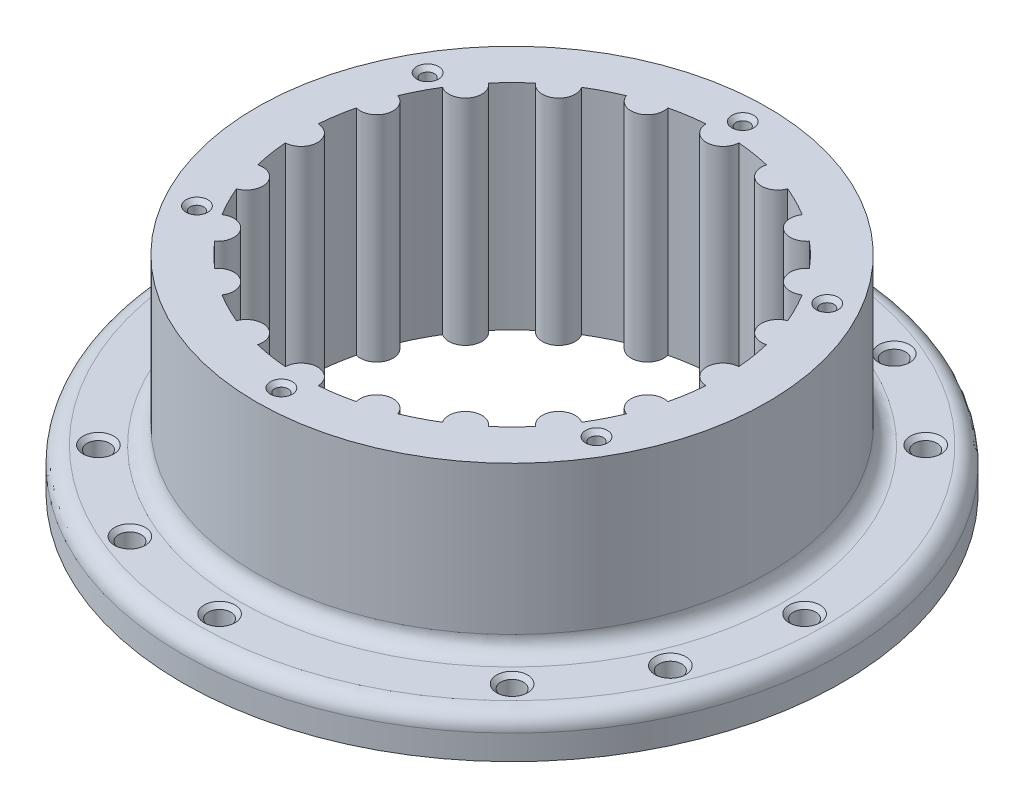
from build123d import *

# Parameters (mm, degrees)
SKETCH1_R                       = 80
SKETCH1_R_2                     = 62
BOSS_EXTRUDE1_DEPTH             = 10
BOSS_EXTRUDE2_DEPTH             = 40
BOSS_EXTRUDE2_DEPTH_BACK        = 12
SKETCH4_R                       = 62
SKETCH4_R_2                     = 51.2
BOSS_EXTRUDE3_REACH             = 122
BOSS_EXTRUDE3_DIRECTION_2_REACH = 122
CIRPATTERN1_COUNT               = 20
SKETCH8_R                       = 2.75
CUT_EXTRUDE4_DEPTH              = 121
CHAMFER1_SIZE                   = 1
CIRPATTERN2_COUNT               = 8
CHAMFER1_OF_CIRPATTERN2_SIZE    = 1
CHAMFER2_SIZE                   = 0.5
SKETCH9_R                       = 1.65
CUT_EXTRUDE5_DEPTH              = 15
CHAMFER3_SIZE                   = 1
SKETCH10_R                      = 2.75
CUT_EXTRUDE6_DEPTH              = 121
CHAMFER4_SIZE                   = 1
CIRPATTERN4_COUNT               = 4
CHAMFER4_OF_CIRPATTERN4_SIZE    = 1
CIRPATTERN3_COUNT               = 6
CHAMFER3_OF_CIRPATTERN3_SIZE    = 1
FILLET1_R                       = 4
FILLET2_R                       = 4


with BuildPart() as part:
    # Sketch1 → Boss-Extrude1 (new body)
    with BuildSketch(Plane(origin=(0, 0, 0), x_dir=(1, 0, 0), z_dir=(0, 1, 0))):
        Circle(SKETCH1_R)
        Circle(SKETCH1_R_2, mode=Mode.SUBTRACT)
    extrude(amount=BOSS_EXTRUDE1_DEPTH)

    # Sketch4 → Boss-Extrude2 (add, two sides: drawn at the far end of the back side and taken through both)
    with BuildSketch(Plane(origin=(0, 10, 0), x_dir=(1, 0, 0), z_dir=(0, 1, 0)).offset(-BOSS_EXTRUDE2_DEPTH_BACK)):
        Circle(SKETCH4_R)
        Circle(SKETCH4_R_2, mode=Mode.SUBTRACT)
    extrude(amount=BOSS_EXTRUDE2_DEPTH + BOSS_EXTRUDE2_DEPTH_BACK)

    # Boss-Extrude3: up to this face of the body (flat: up to its plane)
    boss_extrude3_end = Plane(part.part.faces().sort_by_distance((-60.246375183, 50, 0))[0])
    # Sketch5 → Boss-Extrude3 (add, up to the picked face)
    with BuildSketch(Plane(origin=(0, 10, 0), x_dir=(1, 0, 0), z_dir=(0, 1, 0)), mode=Mode.PRIVATE) as boss_extrude3_sk1:
        with BuildLine():
            ThreePointArc((-51.04375, -3.996947077), (-47.2, 0), (-51.04375, 3.996947077))
            ThreePointArc((-51.04375, 3.996947077), (-51.2, 0), (-51.04375, -3.996947077))
        make_face()
    boss_extrude3_tool1 = split(extrude(boss_extrude3_sk1.sketch, amount=BOSS_EXTRUDE3_REACH, mode=Mode.PRIVATE), bisect_by=boss_extrude3_end, keep=Keep.BOTH, mode=Mode.PRIVATE)
    boss_extrude3 = boss_extrude3_tool1.solids().sort_by(Axis((-49.474514, 10, 0), (0, 1, 0)))[0]
    add(boss_extrude3)

    # Boss-Extrude3 direction 2: up to this face of the body (flat: up to its plane)
    boss_extrude3_direction_2_end = Plane(part.part.faces().sort_by_distance((-60.246375183, -2, 0))[0])
    # Sketch5 → Boss-Extrude3 direction 2 (add, up to the picked face)
    with BuildSketch(Plane(origin=(0, 10, 0), x_dir=(1, 0, 0), z_dir=(0, 1, 0)), mode=Mode.PRIVATE) as boss_extrude3_direction_2_sk1:
        with BuildLine():
            ThreePointArc((-51.04375, -3.996947077), (-47.2, 0), (-51.04375, 3.996947077))
            ThreePointArc((-51.04375, 3.996947077), (-51.2, 0), (-51.04375, -3.996947077))
        make_face()
    boss_extrude3_direction_2_tool1 = split(extrude(boss_extrude3_direction_2_sk1.sketch, amount=-BOSS_EXTRUDE3_DIRECTION_2_REACH, mode=Mode.PRIVATE), bisect_by=boss_extrude3_direction_2_end, keep=Keep.BOTH, mode=Mode.PRIVATE)
    boss_extrude3_direction_2 = boss_extrude3_direction_2_tool1.solids().sort_by(Axis((-49.474514, 10, 0), (0, -1, 0)))[0]
    add(boss_extrude3_direction_2)

    # CirPattern1: Boss-Extrude3, Boss-Extrude3 direction 2 ×20 about axis
    cirpattern1_axis = Axis((0, 50, 0), (0, 1, 0))
    add([boss_extrude3.rotate(cirpattern1_axis, i * 360 / CIRPATTERN1_COUNT) for i in range(1, CIRPATTERN1_COUNT)])
    add([boss_extrude3_direction_2.rotate(cirpattern1_axis, i * 360 / CIRPATTERN1_COUNT) for i in range(1, CIRPATTERN1_COUNT)])

    # Sketch8 → Cut-Extrude4 (cut, through all)
    with BuildSketch(Plane(origin=(0, 10, 0), x_dir=(1, 0, 0), z_dir=(0, 1, 0))):
        with Locations((0, 71)):
            Circle(SKETCH8_R)
    cut_extrude4 = extrude(amount=-CUT_EXTRUDE4_DEPTH, mode=Mode.SUBTRACT)

    # Chamfer1
    chamfer1_edges = [part.edges().sort_by_distance(p)[0] for p in [
        (-2.75, 10, -71),
    ]]
    chamfer(chamfer1_edges, length=CHAMFER1_SIZE)

    # CirPattern2: Cut-Extrude4 ×8 about axis
    cirpattern2_axis = Axis((0, 10, 0), (0, 1, 0))
    for i in range(1, CIRPATTERN2_COUNT):
        add(cut_extrude4.rotate(cirpattern2_axis, i * 360 / CIRPATTERN2_COUNT), mode=Mode.SUBTRACT)

    # Chamfer1 of CirPattern2
    chamfer1_of_cirpattern2_edges = [part.edges().sort_by_distance(p)[0] for p in [
        (-52.149125113, 10, -48.260037816),
        (-71, 10, 2.75),
        (-48.260037816, 10, 52.149125113),
        (2.75, 10, 71),
        (52.149125113, 10, 48.260037816),
        (71, 10, -2.75),
        (48.260037816, 10, -52.149125113),
    ]]
    chamfer(chamfer1_of_cirpattern2_edges, length=CHAMFER1_OF_CIRPATTERN2_SIZE)

    # Chamfer2
    chamfer2_edges = [part.edges().sort_by_distance(p)[0] for p in [
        (-62, -2, 0),
    ]]
    chamfer(chamfer2_edges, length=CHAMFER2_SIZE)

    # Sketch9 → Cut-Extrude5 (cut)
    with BuildSketch(Plane(origin=(0, 50, 0), x_dir=(1, 0, 0), z_dir=(0, 1, 0))):
        with Locations((0, 56)):
            Circle(SKETCH9_R)
    cut_extrude5 = extrude(amount=-CUT_EXTRUDE5_DEPTH, mode=Mode.SUBTRACT)

    # Chamfer3
    chamfer3_edges = [part.edges().sort_by_distance(p)[0] for p in [
        (-1.65, 50, -56),
    ]]
    chamfer(chamfer3_edges, length=CHAMFER3_SIZE)

    # Sketch10 → Cut-Extrude6 (cut, through all)
    with BuildSketch(Plane(origin=(0, 10, 0), x_dir=(1, 0, 0), z_dir=(0, 1, 0))):
        with Locations((27.170523698, 65.595446808)):
            Circle(SKETCH10_R)
    cut_extrude6 = extrude(amount=-CUT_EXTRUDE6_DEPTH, mode=Mode.SUBTRACT)

    # Chamfer4
    chamfer4_edges = [part.edges().sort_by_distance(p)[0] for p in [
        (24.420523698, 10, -65.595446808),
    ]]
    chamfer(chamfer4_edges, length=CHAMFER4_SIZE)

    # CirPattern4: Cut-Extrude6 ×4 about axis
    cirpattern4_axis = Axis((0, 10, 0), (0, 1, 0))
    for i in range(1, CIRPATTERN4_COUNT):
        add(cut_extrude6.rotate(cirpattern4_axis, i * 360 / CIRPATTERN4_COUNT), mode=Mode.SUBTRACT)

    # Chamfer4 of CirPattern4
    chamfer4_of_cirpattern4_edges = [part.edges().sort_by_distance(p)[0] for p in [
        (-65.595446808, 10, -24.420523698),
        (-24.420523698, 10, 65.595446808),
        (65.595446808, 10, 24.420523698),
    ]]
    chamfer(chamfer4_of_cirpattern4_edges, length=CHAMFER4_OF_CIRPATTERN4_SIZE)

    # CirPattern3: Cut-Extrude5 ×6 about axis
    cirpattern3_axis = Axis((0, 50, 0), (0, 1, 0))
    for i in range(1, CIRPATTERN3_COUNT):
        add(cut_extrude5.rotate(cirpattern3_axis, i * 360 / CIRPATTERN3_COUNT), mode=Mode.SUBTRACT)

    # Chamfer3 of CirPattern3
    chamfer3_of_cirpattern3_edges = [part.edges().sort_by_distance(p)[0] for p in [
        (-49.322422612, 50, -26.571058084),
        (-47.672422612, 50, 29.428941916),
        (1.65, 50, 56),
        (49.322422612, 50, 26.571058084),
        (47.672422612, 50, -29.428941916),
    ]]
    chamfer(chamfer3_of_cirpattern3_edges, length=CHAMFER3_OF_CIRPATTERN3_SIZE)

    # Fillet1
    fillet1_edges = [part.edges().sort_by_distance(p)[0] for p in [
        (-62, 10, 0),
    ]]
    fillet(fillet1_edges, radius=FILLET1_R)

    # Fillet2
    fillet2_edges = [part.edges().sort_by_distance(p)[0] for p in [
        (-80, 10, 0),
    ]]
    fillet(fillet2_edges, radius=FILLET2_R)


solid = part.part
